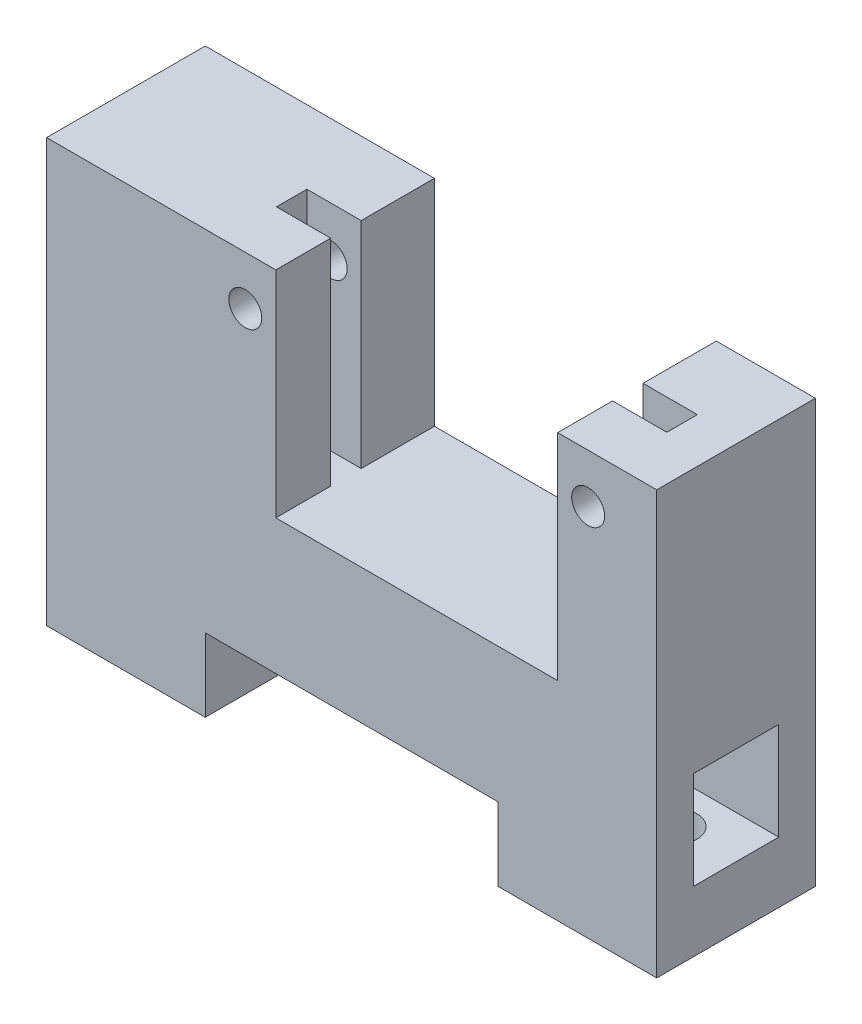
from build123d import *

# Parameters (mm, degrees)
SKETCH1_W                = 45
SKETCH1_H                = 6
BOSS_EXTRUDE1_DEPTH      = 32
SKETCH2_W                = 23.1
SKETCH2_H                = 17.6
CUT_EXTRUDE1_DEPTH       = 56.542776308
SKETCH3_W                = 45
SKETCH3_H                = 20
BOSS_EXTRUDE2_DEPTH      = 6
SKETCH4_W                = 20
SKETCH4_H                = 6
BOSS_EXTRUDE3_DEPTH      = 30
SKETCH5_R                = 1.4
CUT_EXTRUDE2_DEPTH       = 87.423376467
BOSS_EXTRUDE4_DEPTH      = 7
SKETCH7_W                = 32
SKETCH7_H                = 2.5
CUT_EXTRUDE3_DEPTH       = 17.6
SKETCH8_R                = 1.35
CUT_EXTRUDE4_DEPTH       = 86.895285086
CHAMFER1_SIZE            = 1
FILLET1_R                = 1
SKETCH9_W                = 75
SKETCH9_H                = 10
CUT_EXTRUDE5_DEPTH       = 86.895285086
SKETCH10_W               = 45
SKETCH10_H               = 13
BOSS_EXTRUDE5_DEPTH      = 6.65
SKETCH11_W               = 2.83
SKETCH11_H               = 34.65
CUT_EXTRUDE6_DEPTH       = 57.727418415
SKETCH12_W               = 13
SKETCH12_H               = 34.65
BOSS_EXTRUDE6_DEPTH      = 7.83
SKETCH13_W               = 24
SKETCH13_H               = 6
CUT_EXTRUDE7_DEPTH       = 55.509713813
SKETCH14_W               = 7
SKETCH14_H               = 8
CUT_EXTRUDE8_DEPTH       = 10
SKETCH15_W               = 7
SKETCH15_H               = 8
CUT_EXTRUDE9_DEPTH       = 10
M3_CLEARANCE_HOLE1_D     = 3.6
M3_CLEARANCE_HOLE1_DEPTH = 5


with BuildPart() as part:
    # Sketch1 → Boss-Extrude1 (new body)
    with BuildSketch(Plane(origin=(0, 0, 0), x_dir=(1, 0, 0), z_dir=(0, 1, 0))):
        with Locations((22.5, 3)):
            Rectangle(SKETCH1_W, SKETCH1_H)
    extrude(amount=BOSS_EXTRUDE1_DEPTH)

    # Sketch2 → Cut-Extrude1 (cut, through all)
    with BuildSketch(Plane.XY):
        with Locations((22.5, 23.2)):
            Rectangle(SKETCH2_W, SKETCH2_H)
    extrude(amount=-CUT_EXTRUDE1_DEPTH, mode=Mode.SUBTRACT)

    # Sketch3 → Boss-Extrude2 (add)
    with BuildSketch(Plane.XZ):
        with Locations((22.5, -10)):
            Rectangle(SKETCH3_W, SKETCH3_H)
    extrude(amount=BOSS_EXTRUDE2_DEPTH)

    # Sketch4 → Boss-Extrude3 (add)
    with BuildSketch(Plane(origin=(45, 0, 0), x_dir=(0, 0, -1), z_dir=(1, 0, 0))):
        with Locations((10, -3)):
            Rectangle(SKETCH4_W, SKETCH4_H)
    extrude(amount=BOSS_EXTRUDE3_DEPTH)

    # Sketch5 → Cut-Extrude2 (cut, through all)
    with BuildSketch(Plane.XZ.offset(6)):
        with Locations(Location((37.288839919, -16.75, 0), (0, 0, 270))):
            Circle(SKETCH5_R)
        with Locations(Location((47.288839919, -16.75, 0), (0, 0, 270))):
            Circle(SKETCH5_R)
        with Locations(Location((47.288839919, -6.75, 0), (0, 0, 270))):
            Circle(SKETCH5_R)
        with Locations(Location((59.538839919, -16.75, 0), (0, 0, 270))):
            Circle(SKETCH5_R)
        with Locations(Location((71.788839919, -16.75, 0), (0, 0, 270))):
            Circle(SKETCH5_R)
        with Locations(Location((71.788839919, -6.75, 0), (0, 0, 270))):
            Circle(SKETCH5_R)
        with Locations(Location((59.538839919, -6.75, 0), (0, 0, 270))):
            Circle(SKETCH5_R)
    extrude(amount=-CUT_EXTRUDE2_DEPTH, mode=Mode.SUBTRACT)

    # Sketch6 → Boss-Extrude4 (add)
    with BuildSketch(Plane.XY):
        Polygon((0, 32), (0, -6), (45, -6), (45, 0), (45, 32), (34.05, 32), (34.05, 14.4), (10.95, 14.4), (10.95, 32), align=None)
    extrude(amount=BOSS_EXTRUDE4_DEPTH)

    # Sketch7 → Cut-Extrude3 (cut)
    with BuildSketch(Plane(origin=(0, 32, 0), x_dir=(1, 0, 0), z_dir=(0, 1, 0))):
        with Locations((22.5, -1.25)):
            Rectangle(SKETCH7_W, SKETCH7_H)
    extrude(amount=-CUT_EXTRUDE3_DEPTH, mode=Mode.SUBTRACT)

    # Sketch8 → Cut-Extrude4 (cut, through all)
    with BuildSketch(Plane.XY.offset(7)):
        with Locations((8.45, 28)):
            Circle(SKETCH8_R)
        with Locations((36.55, 28)):
            Circle(SKETCH8_R)
    extrude(amount=-CUT_EXTRUDE4_DEPTH, mode=Mode.SUBTRACT)

    # Chamfer1
    chamfer1_edges = [part.edges().sort_by_distance(p)[0] for p in [
        (22.5, -6, 7),
        (0, -6, -6.5),
        (37.5, -6, -20),
        (60, -6, 0),
        (75, -6, -10),
        (45, -6, 3.5),
    ]]
    chamfer(chamfer1_edges, length=CHAMFER1_SIZE)

    # Fillet1
    # the kernel refuses this fillet: 1 mm, written as the material it adds along each edge
    with BuildSketch(Plane(origin=(45, 0, -6), x_dir=(0, 1, 0), z_dir=(0, 0, 1))) as fillet1_piece_1:
        with BuildLine():
            CenterArc((FILLET1_R, -FILLET1_R), FILLET1_R, 90, 90)
            Line((0, -FILLET1_R), (0, 0))
            Line((0, 0), (FILLET1_R, 0))
        make_face()
    extrude(amount=6)
    with BuildSketch(Plane(origin=(45, 0, -6), x_dir=(0, 0, -1), z_dir=(-1, 0, 0))) as fillet1_piece_2:
        with BuildLine():
            CenterArc((FILLET1_R, -FILLET1_R), FILLET1_R, 90, 90)
            Line((0, -FILLET1_R), (0, 0))
            Line((0, 0), (FILLET1_R, 0))
        make_face()
    extrude(amount=45)
    with BuildSketch(Plane(origin=(45, -7.5, 0), x_dir=(1, 0, 0), z_dir=(0, 1, 0))) as fillet1_piece_3_section:
        with BuildLine():
            CenterArc((FILLET1_R, -FILLET1_R), FILLET1_R, 90, 90)
            Line((0, -FILLET1_R), (0, 0))
            Line((0, 0), (FILLET1_R, 0))
        make_face()
    fillet1_piece_3 = extrude(amount=7.5, mode=Mode.PRIVATE)
    fillet1_piece_3 = split(fillet1_piece_3, bisect_by=Plane(origin=(45.042981958, -4.592558865, 0.407441135), z_dir=(0, -0.7071067811865476, 0.7071067811865476)), keep=Keep.TOP, mode=Mode.PRIVATE)
    fillet1_piece_3 = split(fillet1_piece_3, bisect_by=Plane(origin=(45.16446835, -4.83553165, 0.528927527), z_dir=(-0.7071067811865476, 0.7071067811865476, 0)), keep=Keep.TOP, mode=Mode.PRIVATE)
    add(fillet1_piece_3)
    with BuildSketch(Plane(origin=(45, -7.5, 0), x_dir=(1, 0, 0), z_dir=(0, 1, 0))) as fillet1_piece_4_section:
        with BuildLine():
            CenterArc((FILLET1_R, -FILLET1_R), FILLET1_R, 90, 90)
            Line((0, -FILLET1_R), (0, 0))
            Line((0, 0), (FILLET1_R, 0))
        make_face()
    fillet1_piece_4 = extrude(amount=7.5, mode=Mode.PRIVATE)
    fillet1_piece_4 = split(fillet1_piece_4, bisect_by=Plane(origin=(45.528927527, -4.83553165, 0.16446835), z_dir=(0, 0.7071067811865476, -0.7071067811865476)), keep=Keep.TOP, mode=Mode.PRIVATE)
    fillet1_piece_4 = split(fillet1_piece_4, bisect_by=Plane(origin=(45.407441135, -4.592558865, 0.042981958), z_dir=(0.7071067811865476, -0.7071067811865476, 0)), keep=Keep.TOP, mode=Mode.PRIVATE)
    add(fillet1_piece_4)
    with BuildSketch(Plane(origin=(45, -7.5, 0), x_dir=(1, 0, 0), z_dir=(0, 1, 0))) as fillet1_piece_5_section:
        with BuildLine():
            CenterArc((FILLET1_R, -FILLET1_R), FILLET1_R, 90, 90)
            Line((0, -FILLET1_R), (0, 0))
            Line((0, 0), (FILLET1_R, 0))
        make_face()
    fillet1_piece_5 = extrude(amount=7.5, mode=Mode.PRIVATE)
    fillet1_piece_5 = split(fillet1_piece_5, bisect_by=Plane(origin=(45.222376568, -3.546419499, 1.453580501), z_dir=(0, 0.7071067811865476, -0.7071067811865476)), keep=Keep.TOP, mode=Mode.PRIVATE)
    fillet1_piece_5 = split(fillet1_piece_5, bisect_by=Plane(origin=(46.453580501, -3.546419499, 0.222376568), z_dir=(-0.7071067811865476, 0.7071067811865476, 0)), keep=Keep.TOP, mode=Mode.PRIVATE)
    add(fillet1_piece_5)
    with BuildSketch(Plane(origin=(45, 0, -8.5), x_dir=(0, 1, 0), z_dir=(0, 0, 1))) as fillet1_piece_6a_section:
        with BuildLine():
            CenterArc((FILLET1_R, -FILLET1_R), FILLET1_R, 90, 90)
            Line((0, -FILLET1_R), (0, 0))
            Line((0, 0), (FILLET1_R, 0))
        make_face()
    fillet1_piece_6a = extrude(amount=8.5, mode=Mode.PRIVATE)
    fillet1_piece_6a = split(fillet1_piece_6a, bisect_by=Plane(origin=(45.224393795, 0.227043758, -6), z_dir=(0, 0, -1)), keep=Keep.TOP, mode=Mode.PRIVATE)
    fillet1_piece_6a = fillet1_piece_6a - Plane(origin=(47.288839919, 0.227043758, -6.75), x_dir=(0, 0, -1), z_dir=(0, -1, 0)) * Cylinder(1.4, 21, mode=Mode.PRIVATE)
    with BuildSketch(Plane(origin=(47.5, 0, -6), x_dir=(0, 0, -1), z_dir=(-1, 0, 0))) as fillet1_piece_6b_section:
        with BuildLine():
            CenterArc((FILLET1_R, -FILLET1_R), FILLET1_R, 90, 90)
            Line((0, -FILLET1_R), (0, 0))
            Line((0, 0), (FILLET1_R, 0))
        make_face()
    fillet1_piece_6b = extrude(amount=47.5, mode=Mode.PRIVATE)
    fillet1_piece_6b = split(fillet1_piece_6b, bisect_by=Plane(origin=(45, 0.236066937, -6.212082633), z_dir=(1, 0, 0)), keep=Keep.TOP, mode=Mode.PRIVATE)
    fillet1_piece_6b = fillet1_piece_6b - Plane(origin=(47.288839919, 0.236066937, -6.75), x_dir=(0, 0, -1), z_dir=(0, -1, 0)) * Cylinder(1.4, 99, mode=Mode.PRIVATE)
    fillet1_piece_6 = fillet1_piece_6a & fillet1_piece_6b
    add(fillet1_piece_6)
    with BuildSketch(Plane(origin=(45, -7.5, 0), x_dir=(1, 0, 0), z_dir=(0, 1, 0))) as fillet1_piece_7a_section:
        with BuildLine():
            CenterArc((FILLET1_R, -FILLET1_R), FILLET1_R, 90, 90)
            Line((0, -FILLET1_R), (0, 0))
            Line((0, 0), (FILLET1_R, 0))
        make_face()
    fillet1_piece_7a = extrude(amount=10, mode=Mode.PRIVATE)
    fillet1_piece_7a = split(fillet1_piece_7a, bisect_by=Plane(origin=(45.226395114, 0, 0.226395114), z_dir=(0, 1, 0)), keep=Keep.TOP, mode=Mode.PRIVATE)
    with BuildSketch(Plane(origin=(45, 0, -6), x_dir=(0, 1, 0), z_dir=(0, 0, 1))) as fillet1_piece_7b_section:
        with BuildLine():
            CenterArc((FILLET1_R, -FILLET1_R), FILLET1_R, 90, 90)
            Line((0, -FILLET1_R), (0, 0))
            Line((0, 0), (FILLET1_R, 0))
        make_face()
    fillet1_piece_7b = extrude(amount=8.5, mode=Mode.PRIVATE)
    fillet1_piece_7b = split(fillet1_piece_7b, bisect_by=Plane(origin=(45.226395114, 0.226395114, 0), z_dir=(0, 0, 1)), keep=Keep.TOP, mode=Mode.PRIVATE)
    fillet1_piece_7 = fillet1_piece_7a & fillet1_piece_7b
    add(fillet1_piece_7)

    # Sketch9 → Cut-Extrude5 (cut, through all)
    with BuildSketch(Plane.XY.offset(7)):
        with Locations((37.5, -1)):
            Rectangle(SKETCH9_W, SKETCH9_H)
    extrude(amount=-CUT_EXTRUDE5_DEPTH, mode=Mode.SUBTRACT)

    # Sketch10 → Boss-Extrude5 (add)
    with BuildSketch(Plane.XZ.offset(-4)):
        with Locations((22.5, 0.5)):
            Rectangle(SKETCH10_W, SKETCH10_H)
    extrude(amount=BOSS_EXTRUDE5_DEPTH)

    # Sketch11 → Cut-Extrude6 (cut, through all)
    with BuildSketch(Plane(origin=(0, 0, -6), x_dir=(-1, 0, 0), z_dir=(0, 0, -1))):
        with Locations((-43.585, 14.675)):
            Rectangle(SKETCH11_W, SKETCH11_H)
    extrude(amount=-CUT_EXTRUDE6_DEPTH, mode=Mode.SUBTRACT)

    # Sketch12 → Boss-Extrude6 (add)
    with BuildSketch(Plane.ZY):
        with Locations((0.5, 14.675)):
            Rectangle(SKETCH12_W, SKETCH12_H)
    extrude(amount=BOSS_EXTRUDE6_DEPTH)

    # Sketch13 → Cut-Extrude7 (cut, through all)
    with BuildSketch(Plane(origin=(0, 0, -6), x_dir=(-1, 0, 0), z_dir=(0, 0, -1))):
        with Locations((-17.17, 0.35)):
            Rectangle(SKETCH13_W, SKETCH13_H)
    extrude(amount=-CUT_EXTRUDE7_DEPTH, mode=Mode.SUBTRACT)

    # Sketch14 → Cut-Extrude8 (cut)
    with BuildSketch(Plane(origin=(42.17, 0, 0), x_dir=(0, 0, -1), z_dir=(1, 0, 0))):
        with Locations((-0.5, 6.35)):
            Rectangle(SKETCH14_W, SKETCH14_H)
    extrude(amount=-CUT_EXTRUDE8_DEPTH, mode=Mode.SUBTRACT)

    # Sketch15 → Cut-Extrude9 (cut)
    with BuildSketch(Plane.ZY.offset(7.83)):
        with Locations((0.5, 6.35)):
            Rectangle(SKETCH15_W, SKETCH15_H)
    extrude(amount=-CUT_EXTRUDE9_DEPTH, mode=Mode.SUBTRACT)

    # M3 Clearance Hole1
    with Locations(Plane(origin=(0, -2.65, 0), x_dir=(-1, 0, 0), z_dir=(0, -1, 0))):
        with Locations((2.83, -0.5), (-37.17, -0.5)):
            Hole(M3_CLEARANCE_HOLE1_D / 2, depth=M3_CLEARANCE_HOLE1_DEPTH)


solid = part.part
